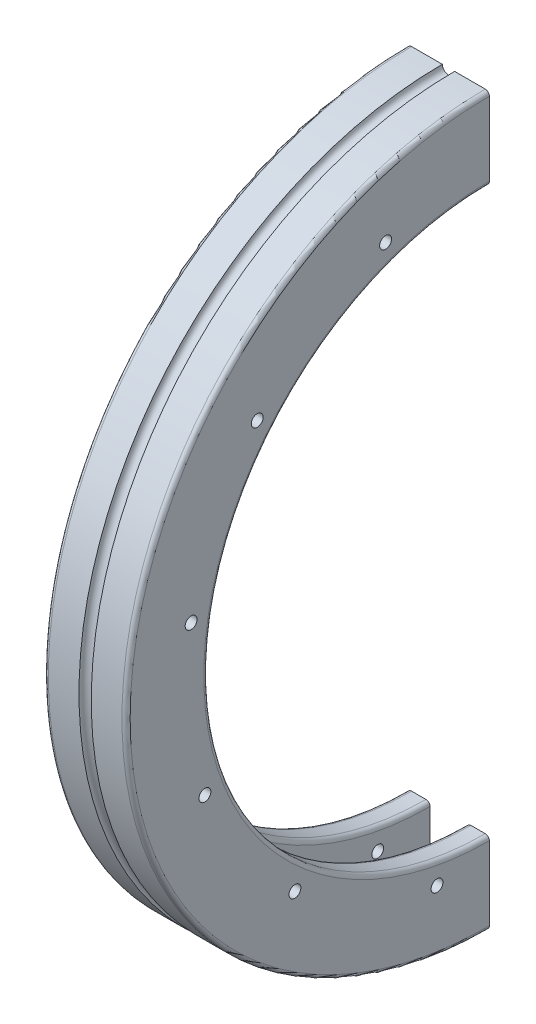
from build123d import *

# Parameters (mm, degrees)
REVOLVE1_ANGLE          = 180
BOSS_EXTRUDE5_START     = -20
BOSS_EXTRUDE5_OUTLINE_R = 1.45
BOSS_EXTRUDE5_DEPTH     = 20
FILLET1_R               = 1
FILLET2_R               = 1
FILLET3_R               = 1


# Read off the part's stored shape, not the designer's step: Boss-Extrude5
with BuildPart() as part:
    # Sketch1 → Revolve1 (revolve)
    with BuildSketch(Plane.XY):
        with BuildLine():
            Line((-7.404589955, 9.946191987), (-7.404589955, 29.946191987))
            Line((-7.404589955, 29.946191987), (1.095410045, 29.946191987))
            ThreePointArc((1.095410045, 29.946191987), (2.595410045, 28.446191987), (4.095410045, 29.946191987))
            Line((4.095410045, 29.946191987), (12.595410045, 29.946191987))
            Line((12.595410045, 29.946191987), (12.595410045, 9.946191987))
            Line((12.595410045, 9.946191987), (7.095410045, 9.946191987))
            Line((7.095410045, 9.946191987), (7.095410045, 21.162110611))
            Line((7.095410045, 21.162110611), (-1.904589955, 21.162110611))
            Line((-1.904589955, 21.162110611), (-1.904589955, 9.946191987))
            Line((-1.904589955, 9.946191987), (-7.404589955, 9.946191987))
        make_face()
    revolve(axis=Axis((-85.384931054, -58.837889389, 0), (1, 0, 0)), revolution_arc=REVOLVE1_ANGLE)

    # Boss-Extrude5 outline → Boss-Extrude5 (cut)
    with BuildSketch(Plane.ZY.offset(7.404589955).offset(BOSS_EXTRUDE5_START)):
        with Locations((25.365468004, 10.67896492)):
            Circle(BOSS_EXTRUDE5_OUTLINE_R)
        with Locations((47.520651548, -115.563436336)):
            Circle(BOSS_EXTRUDE5_OUTLINE_R)
        with Locations((72.886064731, -46.046424732)):
            Circle(BOSS_EXTRUDE5_OUTLINE_R)
        with Locations((56.725485337, -11.317164297)):
            Circle(BOSS_EXTRUDE5_OUTLINE_R)
        with Locations((69.516903931, -84.203221399)):
            Circle(BOSS_EXTRUDE5_OUTLINE_R)
        with Locations((12.791101566, -131.723684009)):
            Circle(BOSS_EXTRUDE5_OUTLINE_R)
    extrude(amount=BOSS_EXTRUDE5_DEPTH, mode=Mode.SUBTRACT)

    # Fillet1
    fillet1_edges = [part.edges().sort_by_distance(p)[0] for p in [
        (12.595410045, -58.837889389, 88.784081376),
    ]]
    fillet(fillet1_edges, radius=FILLET1_R)

    # Fillet2
    fillet2_edges = [part.edges().sort_by_distance(p)[0] for p in [
        (-7.404589955, -58.837889389, 88.784081376),
    ]]
    fillet(fillet2_edges, radius=FILLET2_R)

    # Fillet3
    fillet3_edges = [part.edges().sort_by_distance(p)[0] for p in [
        (-7.404589955, -58.837889389, 68.784081376),
        (12.595410045, -58.837889389, 68.784081376),
        (7.095410045, -58.837889389, 68.784081376),
        (-1.904589955, -58.837889389, 68.784081376),
    ]]
    fillet(fillet3_edges, radius=FILLET3_R)


solid = part.part
